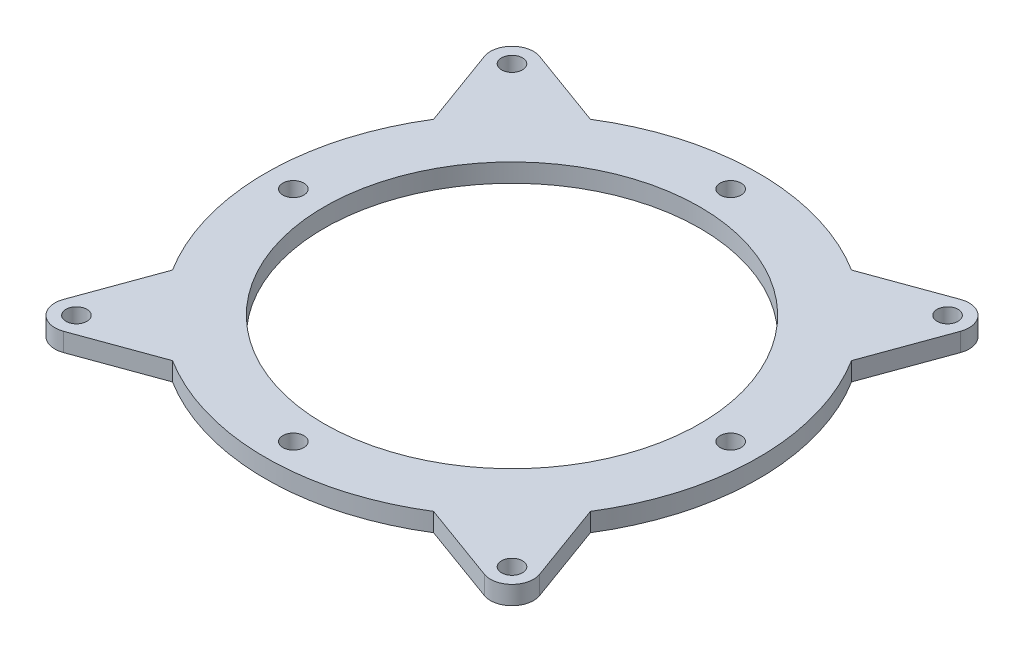
from build123d import *

# Parameters (mm, degrees)
SKETCH_1_R      = 30.5
SKETCH_1_R_2    = 1.7
EXTRUDE_1_DEPTH = 3


with BuildPart() as part:
    # 草图1 → 凸台-拉伸1 (new body)
    with BuildSketch(Plane(origin=(0, 0, 0), x_dir=(1, 0, 0), z_dir=(0, 1, 0))):
        with BuildLine():
            Line((34.158268558, 38.644263232), (21.19197667, 33.924918936))
            ThreePointArc((21.19197667, 33.924918936), (0, 40), (-21.19197667, 33.924918936))
            Line((-21.19197667, 33.924918936), (-34.158268558, 38.644263232))
            ThreePointArc((-34.158268558, 38.644263232), (-37.830212793, 37.830212793), (-38.644263232, 34.158268558))
            Line((-38.644263232, 34.158268558), (-33.924918936, 21.19197667))
            ThreePointArc((-33.924918936, 21.19197667), (-40, 0), (-33.924918936, -21.19197667))
            Line((-33.924918936, -21.19197667), (-38.644263232, -34.158268558))
            ThreePointArc((-38.644263232, -34.158268558), (-37.830212793, -37.830212793), (-34.158268558, -38.644263232))
            Line((-34.158268558, -38.644263232), (-21.19197667, -33.924918936))
            ThreePointArc((-21.19197667, -33.924918936), (0, -40), (21.19197667, -33.924918936))
            Line((21.19197667, -33.924918936), (34.158268558, -38.644263232))
            ThreePointArc((34.158268558, -38.644263232), (37.830212793, -37.830212793), (38.644263232, -34.158268558))
            Line((38.644263232, -34.158268558), (33.924918936, -21.19197667))
            ThreePointArc((33.924918936, -21.19197667), (40, 0), (33.924918936, 21.19197667))
            Line((33.924918936, 21.19197667), (38.644263232, 34.158268558))
            ThreePointArc((38.644263232, 34.158268558), (37.830212793, 37.830212793), (34.158268558, 38.644263232))
        make_face()
        Circle(SKETCH_1_R, mode=Mode.SUBTRACT)
        with Locations((0, 35.5)):
            Circle(SKETCH_1_R_2, mode=Mode.SUBTRACT)
        with Locations((35.5, 0)):
            Circle(SKETCH_1_R_2, mode=Mode.SUBTRACT)
        with Locations((0, -35.5)):
            Circle(SKETCH_1_R_2, mode=Mode.SUBTRACT)
        with Locations((-35.5, 0)):
            Circle(SKETCH_1_R_2, mode=Mode.SUBTRACT)
        with Locations((35.355339059, 35.355339059)):
            Circle(SKETCH_1_R_2, mode=Mode.SUBTRACT)
        with Locations((35.355339059, -35.355339059)):
            Circle(SKETCH_1_R_2, mode=Mode.SUBTRACT)
        with Locations((-35.355339059, -35.355339059)):
            Circle(SKETCH_1_R_2, mode=Mode.SUBTRACT)
        with Locations((-35.355339059, 35.355339059)):
            Circle(SKETCH_1_R_2, mode=Mode.SUBTRACT)
    extrude(amount=EXTRUDE_1_DEPTH)


solid = part.part
